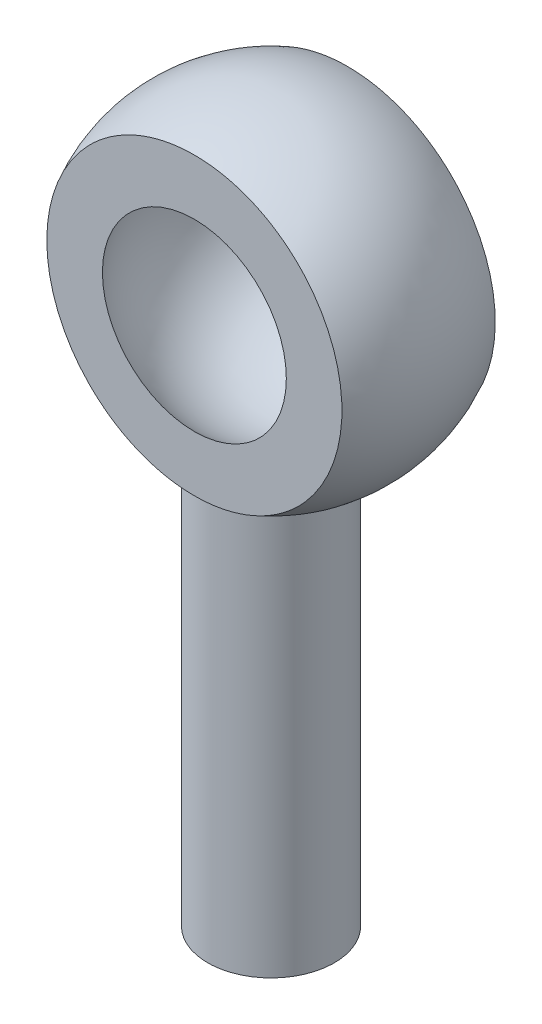
from build123d import *

# Parameters (mm, degrees)
SKETCH1_R               = 4.7625
BOSS_EXTRUDE1_DEPTH     = 42
CUT_EXTRUDE2_DEPTH      = 58.295287764
CUT_EXTRUDE2_DEPTH_BACK = 58.295287764
SKETCH4_W               = 10
SKETCH4_H               = 25


with BuildPart() as part:
    # Sketch1 → Boss-Extrude1 (new body)
    with BuildSketch(Plane(origin=(0, 0, 0), x_dir=(1, 0, 0), z_dir=(0, 1, 0))):
        Circle(SKETCH1_R)
    extrude(amount=BOSS_EXTRUDE1_DEPTH)

    # Sketch2 → Revolve4 (revolve)
    with BuildSketch(Plane.XY):
        with BuildLine():
            Line((0, 54.5), (0, 29.5))
            ThreePointArc((0, 29.5), (-12.5, 42), (0, 54.5))
        make_face()
    revolve(axis=Axis((0, 54.5, 0), (0, -1, 0)))

    # Sketch4 → Cut-Extrude2 (cut, two sides: drawn at the far end of the back side and taken through both)
    with BuildSketch(Plane(origin=(0, 0, 0), x_dir=(0, 0, -1), z_dir=(1, 0, 0)).offset(-CUT_EXTRUDE2_DEPTH_BACK)):
        with Locations((-10.7625, 42.942812031)):
            Rectangle(SKETCH4_W, SKETCH4_H)
        with Locations((10.76, 42.942812031)):
            Rectangle(SKETCH4_W, SKETCH4_H)
    extrude(amount=CUT_EXTRUDE2_DEPTH + CUT_EXTRUDE2_DEPTH_BACK, mode=Mode.SUBTRACT)

    # Sketch5 → Cut-Revolve1 (revolve, cut)
    with BuildSketch(Plane.XY):
        with BuildLine():
            Line((0, 51), (0, 33))
            ThreePointArc((0, 33), (-9, 42), (0, 51))
        make_face()
    revolve(axis=Axis((0, 51, 0), (0, -1, 0)), mode=Mode.SUBTRACT)


solid = part.part
